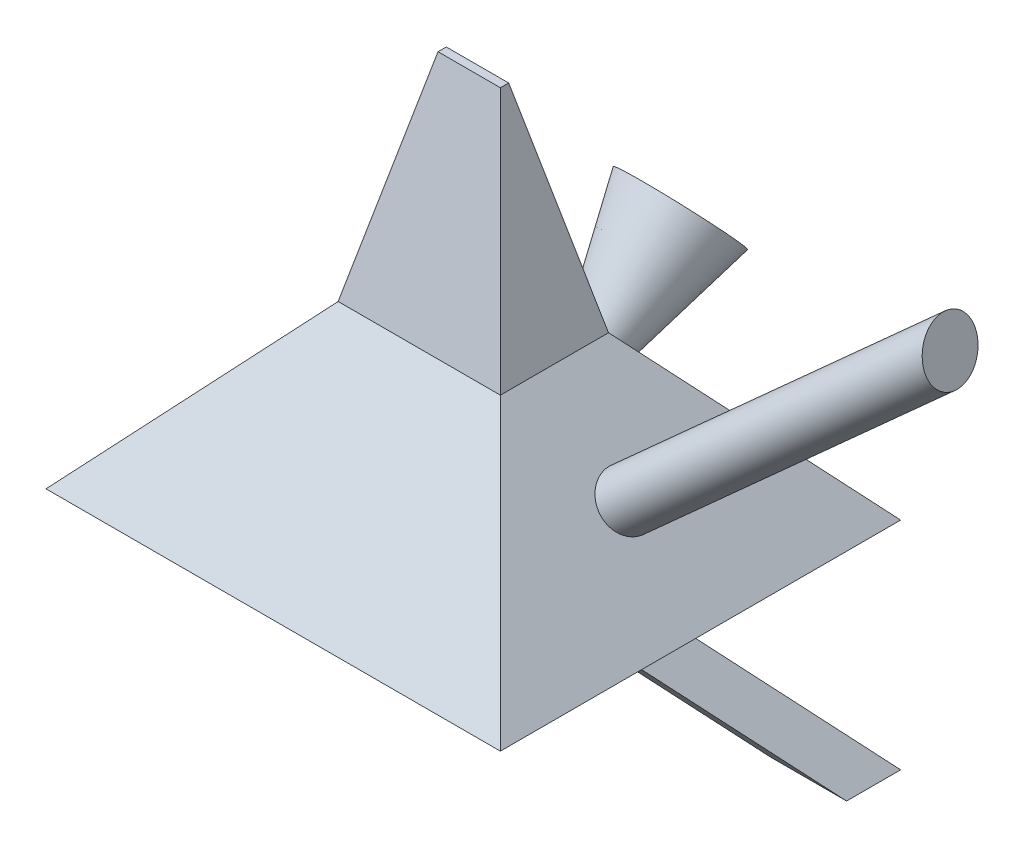
from build123d import *

# Parameters (mm, degrees)
CROQUIS1_W                        = 750
CROQUIS1_H                        = 500
SALIENTE_EXTRUIR1_DEPTH           = 1000
SALIENTE_EXTRUIR1_TAPER           = 13
SALIENTE_EXTRUIR1_OTHER_WAY_DEPTH = 750
SALIENTE_EXTRUIR1_OTHER_WAY_TAPER = -42
CROQUIS3_R                        = 125
SALIENTE_EXTRUIR3_DEPTH           = 497.562106
SALIENTE_EXTRUIR3_DRAFT           = -15
SALIENTE_EXTRUIR4_REACH           = 2572.697
CROQUIS4_R                        = 125


with BuildPart() as part:
    # Croquis1 → Saliente-Extruir1 (new body)
    with BuildSketch(Plane(origin=(0, 0, 0), x_dir=(1, 0, 0), z_dir=(0, 1, 0))):
        Rectangle(CROQUIS1_W, CROQUIS1_H)
    extrude(amount=SALIENTE_EXTRUIR1_DEPTH, taper=SALIENTE_EXTRUIR1_TAPER)

    # Croquis1 → Saliente-Extruir1 other way (add)
    with BuildSketch(Plane(origin=(0, 0, 0), x_dir=(1, 0, 0), z_dir=(0, 1, 0))):
        Rectangle(CROQUIS1_W, CROQUIS1_H)
    extrude(amount=-SALIENTE_EXTRUIR1_OTHER_WAY_DEPTH, taper=SALIENTE_EXTRUIR1_OTHER_WAY_TAPER)

    # Saliente-Extruir2: read off the stored shape, not the designer's step
    # Saliente-Extruir2: loft between two sections, ruled curve by curve
    saliente_extruir2_from = [
        Edge.make_line((1050.303033223, -1750, -925.303033223), (700.303033223, -1750, -925.303033223)),
        Edge.make_line((1050.303033223, -1750, -675.303033223), (1050.303033223, -1750, -925.303033223)),
        Edge.make_line((700.303033223, -1750, -675.303033223), (1050.303033223, -1750, -675.303033223)),
        Edge.make_line((700.303033223, -1750, -925.303033223), (700.303033223, -1750, -675.303033223)),
    ]
    saliente_extruir2_to = [
        Edge.make_line((149.898988926, -750, -24.898988926), (-200.101011074, -750, -24.898988926)),
        Edge.make_line((149.898988926, -750, 225.101011074), (149.898988926, -750, -24.898988926)),
        Edge.make_line((-200.101011074, -750, 225.101011074), (149.898988926, -750, 225.101011074)),
        Edge.make_line((-200.101011074, -750, -24.898988926), (-200.101011074, -750, 225.101011074)),
    ]
    saliente_extruir2 = Solid(Shell([*[Face.make_surface_from_curves(saliente_extruir2_from[k], saliente_extruir2_to[k]) for k in range(4)], Face(Wire(saliente_extruir2_from)), Face(Wire(saliente_extruir2_to))]))
    add(saliente_extruir2)


with BuildPart() as saliente_extruir3_tool:
    # Croquis3 → Saliente-Extruir3 (with draft: the straight prism first)
    with BuildSketch(Plane(origin=(0, 124.315236921, -138.066057908), x_dir=(-1, 0, 0), z_dir=(0, 0.6691306063588595, -0.7431448254773932))):
        with Locations((0, -671.894925192)):
            Circle(CROQUIS3_R)
    extrude(amount=SALIENTE_EXTRUIR3_DEPTH)
    # Saliente-Extruir3: the draft: its side faces are tilted about the plane it starts from
    saliente_extruir3_sides = [saliente_extruir3_tool.faces().sort_by_distance(p)[0] for p in [
        (125, -208.532983156, -772.531868825),
    ]]
    draft(saliente_extruir3_sides, Plane(origin=(0, 124.315236921, -138.066057908), x_dir=(-1, 0, 0), z_dir=(0, 0.6691306063588595, -0.7431448254773932)), SALIENTE_EXTRUIR3_DRAFT)


with BuildPart() as part_1:
    add(part.part)

    # Saliente-Extruir3: add saliente_extruir3_tool
    add(saliente_extruir3_tool.part)

    # Saliente-Extruir4: up to this plane
    saliente_extruir4_end = Plane(origin=(2323.74012957, 449.902108688, 250), z_dir=(0.9743700647852351, 0.2249510543438655, 0))
    # Croquis4 → Saliente-Extruir4 (add, up to the surface)
    with BuildSketch(Plane(origin=(207.099086863, 186.472855382, 0), x_dir=(0, 0, -1), z_dir=(0.7431448254773932, 0.6691306063588595, 0)), mode=Mode.PRIVATE) as saliente_extruir4_sk1:
        with Locations(Location((0, -755.536250987, 0), (0, 0, 270))):
            Circle(CROQUIS4_R)
    saliente_extruir4_tool1 = split(extrude(saliente_extruir4_sk1.sketch, amount=SALIENTE_EXTRUIR4_REACH, mode=Mode.PRIVATE), bisect_by=saliente_extruir4_end, keep=Keep.BOTH, mode=Mode.PRIVATE)
    add(saliente_extruir4_tool1.solids().sort_by_distance((712.651517, -375, 0))[0])


solid = part_1.part
